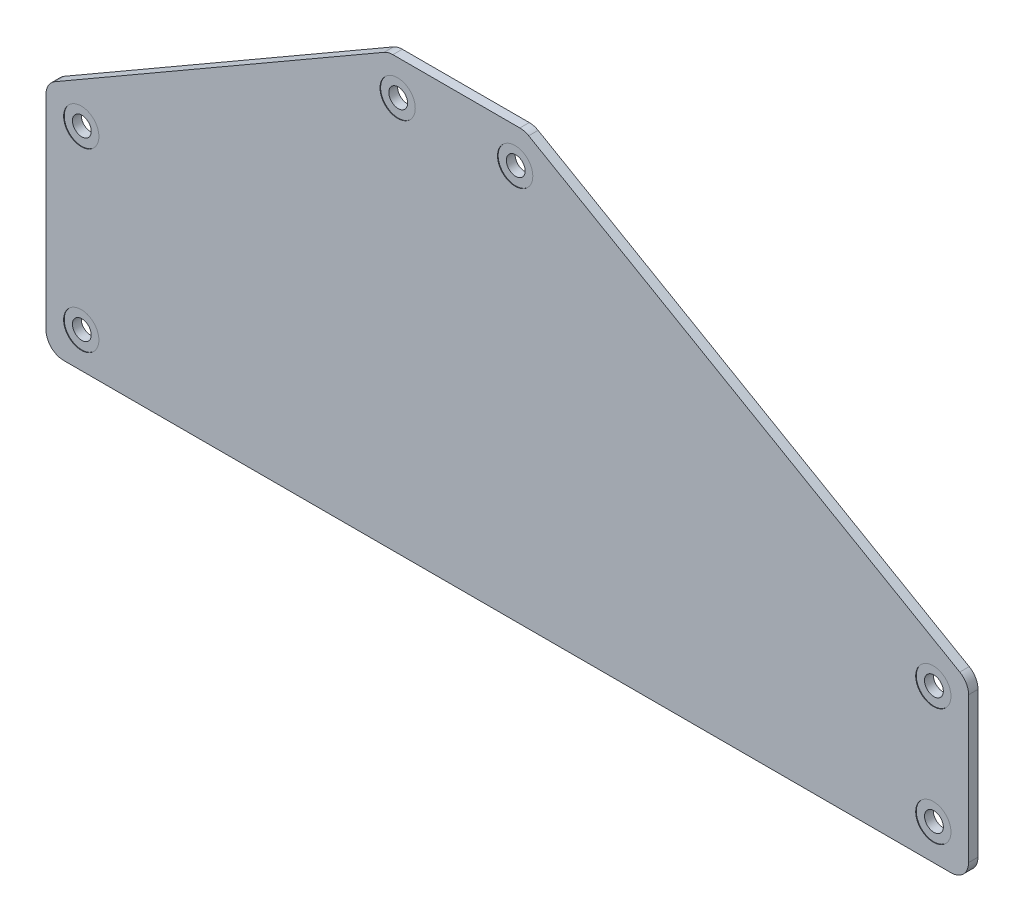
from build123d import *

# Parameters (mm, degrees)
SKETCH1_R           = 1.6
BOSS_EXTRUDE1_DEPTH = 1.6
FILLET1_R           = 3
SKETCH2_R           = 3
CUT_EXTRUDE1_DEPTH  = 0.1


with BuildPart() as part:
    # Sketch1 → Boss-Extrude1 (new body)
    with BuildSketch(Plane.XY):
        Polygon((0, 0), (157, 0), (157, 29.464101615), (81.447441117, 73.084391824), (58.232050808, 73.084391824), (0, 39.464101615), align=None)
        with Locations((6, 36)):
            Circle(SKETCH1_R, mode=Mode.SUBTRACT)
        with Locations((6, 6)):
            Circle(SKETCH1_R, mode=Mode.SUBTRACT)
        with Locations((151, 6)):
            Circle(SKETCH1_R, mode=Mode.SUBTRACT)
        with Locations((151, 26)):
            Circle(SKETCH1_R, mode=Mode.SUBTRACT)
        with Locations((79.839745962, 67.084391824)):
            Circle(SKETCH1_R, mode=Mode.SUBTRACT)
        with Locations((59.839745962, 67.084391824)):
            Circle(SKETCH1_R, mode=Mode.SUBTRACT)
    extrude(amount=BOSS_EXTRUDE1_DEPTH)

    # Fillet1
    fillet1_edges = [part.edges().sort_by_distance(p)[0] for p in [
        (0, 39.464101615, 0.8),
        (58.232050808, 73.084391824, 0.8),
        (81.447441117, 73.084391824, 0.8),
        (157, 29.464101615, 0.8),
        (157, 0, 0.8),
        (0, 0, 0.8),
    ]]
    fillet(fillet1_edges, radius=FILLET1_R)

    # Sketch2 → Cut-Extrude1 (cut)
    with BuildSketch(Plane.XY.offset(1.6)):
        with Locations((6, 6)):
            Circle(SKETCH2_R)
        with Locations((6, 36)):
            Circle(SKETCH2_R)
        with Locations((59.839745962, 67.084391824)):
            Circle(SKETCH2_R)
        with Locations((79.839745962, 67.084391824)):
            Circle(SKETCH2_R)
        with Locations((151, 26)):
            Circle(SKETCH2_R)
        with Locations((151, 6)):
            Circle(SKETCH2_R)
    extrude(amount=-CUT_EXTRUDE1_DEPTH, mode=Mode.SUBTRACT)


solid = part.part
